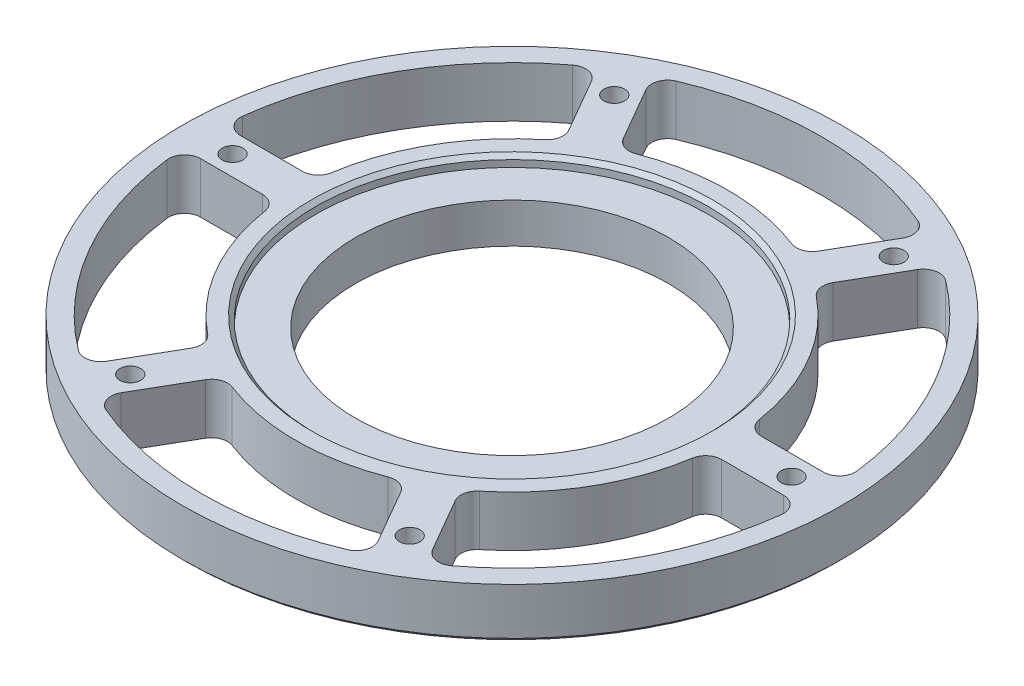
from build123d import *

# Parameters (mm, degrees)
F_6_0_204_DIAMETER_HOLE1_D = 5.1816
CIRPATTERN3_COUNT          = 6
CUT_EXTRUDE1_DEPTH         = 118.43208675655899
FILLET1_R                  = 4
CIRPATTERN4_COUNT          = 6
FILLET1_OF_CIRPATTERN4_R   = 4
CHAMFER1_SIZE              = 1
CHAMFER2_SIZE              = 1


with BuildPart() as part:
    # Sketch2 → Revolve1 (revolve)
    with BuildSketch(Plane(origin=(0, 0, 0), x_dir=(0, 0, -1), z_dir=(1, 0, 0))):
        Polygon((-39.2125, -8.7e-16), (-82.55, -5.31e-15), (-82.55, 12.699999999999994), (-49.2125, 12.699999999999994), (-49.21250000000001, 9.999999999999998), (-39.21250000000001, 9.999999999999998), align=None)
    revolve(axis=Axis((0, -0.6350000000000053, 0), (0, 1, 0)))

    # #6 (0.204) Diameter Hole1 (through all)
    with Locations(Plane(origin=(0, 12.699999999999994, 0), x_dir=(1, 0, 0), z_dir=(0, 1, 0))):
        with Locations((-35, 60.621778265)):
            f_6_0_204_diameter_hole1 = Hole(F_6_0_204_DIAMETER_HOLE1_D / 2)

    # CirPattern3: #6 (0.204) Diameter Hole1 ×6 about axis
    cirpattern3_axis = Axis((0, -0.6350000000000053, 0), (0, 1, 0))
    for i in range(1, CIRPATTERN3_COUNT):
        add(f_6_0_204_diameter_hole1.rotate(cirpattern3_axis, i * 360 / CIRPATTERN3_COUNT), mode=Mode.SUBTRACT)

    # Sketch8 → Cut-Extrude1 (cut, through all)
    with BuildSketch(Plane(origin=(0, 12.699999999999994, 0), x_dir=(1, 0, 0), z_dir=(0, 1, 0))):
        with BuildLine():
            Line((-34.36419588509058, 69.52053323422601), (-22.660589701137393, 49.249292691841845))
            ThreePointArc((-22.660589701137393, 49.249292691841845), (3.32e-15, 54.212500000000006), (22.660589701137393, 49.249292691841845))
            Line((22.660589701137393, 49.249292691841845), (34.36419588509058, 69.52053323422601))
            ThreePointArc((34.36419588509058, 69.52053323422601), (4.75e-15, 77.55), (-34.36419588509058, 69.52053323422601))
        make_face()
    cut_extrude1 = extrude(amount=-CUT_EXTRUDE1_DEPTH, mode=Mode.SUBTRACT)

    # Fillet1
    fillet1_edges = [part.edges().sort_by_distance(p)[0] for p in [
        (34.36419588509058, 6.349999999999996, -69.52053323422601),
        (22.660589701137397, 6.349999999999996, -49.249292691841845),
        (-34.36419588509059, 6.349999999999996, -69.52053323422601),
        (-22.660589701137393, 6.349999999999996, -49.249292691841845),
    ]]
    fillet(fillet1_edges, radius=FILLET1_R)

    # CirPattern4: Cut-Extrude1 ×6 about axis
    cirpattern4_axis = Axis((0, -0.6350000000000053, 0), (0, 1, 0))
    for i in range(1, CIRPATTERN4_COUNT):
        add(cut_extrude1.rotate(cirpattern4_axis, i * 360 / CIRPATTERN4_COUNT), mode=Mode.SUBTRACT)

    # Fillet1 of CirPattern4
    fillet1_of_cirpattern4_edges = [part.edges().sort_by_distance(p)[0] for p in [
        (-43.024449922934764, 6.349999999999996, -64.52053323422612),
        (-31.320843738981637, 6.349999999999996, -44.24929269184193),
        (-77.38864580802536, 6.349999999999996, -4.99999999999989),
        (-53.981433440119034, 6.349999999999996, -4.999999999999929),
        (-77.38864580802536, 6.349999999999996, 4.999999999999872),
        (-53.981433440119034, 6.349999999999996, 4.999999999999904),
        (-43.02444992293478, 6.349999999999996, 64.52053323422612),
        (-31.32084373898165, 6.349999999999996, 44.249292691841916),
        (-34.36419588509059, 6.349999999999996, 69.52053323422601),
        (-22.660589701137404, 6.349999999999996, 49.249292691841845),
        (34.36419588509058, 6.349999999999996, 69.52053323422601),
        (22.660589701137386, 6.349999999999996, 49.249292691841845),
        (43.02444992293474, 6.349999999999996, 64.52053323422614),
        (31.320843738981612, 6.349999999999996, 44.249292691841944),
        (77.38864580802536, 6.349999999999996, 4.999999999999922),
        (53.98143344011903, 6.349999999999996, 4.999999999999947),
        (77.38864580802536, 6.349999999999996, -4.999999999999897),
        (53.981433440119034, 6.349999999999996, -4.999999999999925),
        (43.024449922934764, 6.349999999999996, -64.52053323422614),
        (31.320843738981637, 6.349999999999996, -44.24929269184193),
    ]]
    fillet(fillet1_of_cirpattern4_edges, radius=FILLET1_OF_CIRPATTERN4_R)

    # Chamfer1
    chamfer1_edges = [part.edges().sort_by_distance(p)[0] for p in [
        (6.03e-15, 12.699999999999994, -49.2125),
    ]]
    chamfer(chamfer1_edges, length=CHAMFER1_SIZE)

    # Chamfer2
    chamfer2_edges = [part.edges().sort_by_distance(p)[0] for p in [
        (4.677e-14, -5.33e-15, -82.55),
    ]]
    chamfer(chamfer2_edges, length=CHAMFER2_SIZE)


solid = part.part
